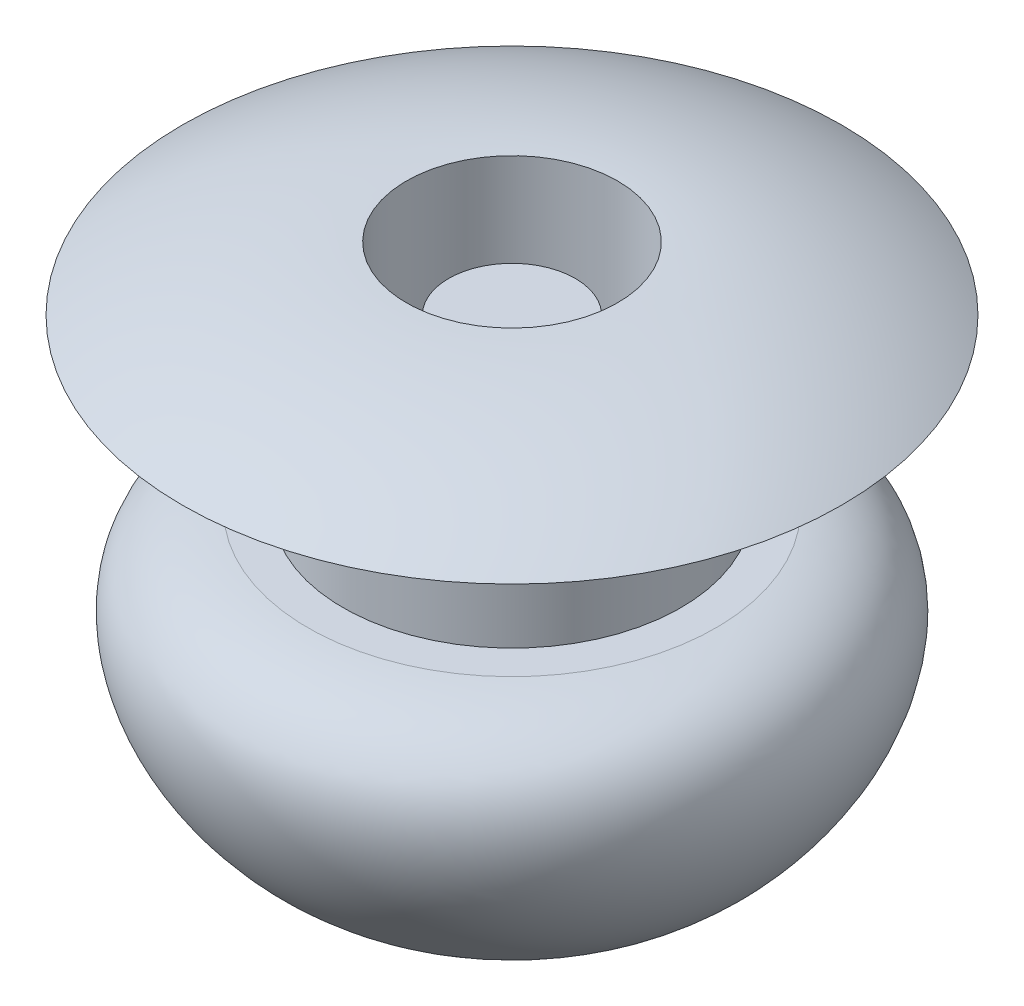
from build123d import *


with BuildPart() as part:
    # Szkic1 → Obrót1 (revolve)
    with BuildSketch(Plane(origin=(0, 0, 0), x_dir=(0, 0, -1), z_dir=(1, 0, 0))):
        with BuildLine():
            Line((0, 0), (0, -2.000008703))
            Line((0, -2.000008703), (0, -3.500008703))
            add(Edge.make_bspline(
                [(-0.956030427, -3.378199373), (-0.520263876, -3.500008703), (0, -3.500008703)],
                knots=[4.134444875, 4.134444875, 4.134444875, 4.71238898, 4.71238898, 4.71238898], degree=2, weights=[1, 0.958537313, 1]))
            add(Edge.make_bspline(
                [(-2.413891755, -2.000008703), (-3.858559437, -2.163305389), (-3.558358928, -4.322989065), (-0.971318098, -5.871948719), (-0.341145137, -3.792040612), (-0.956030427, -3.378199373)],
                knots=[0, 0, 0, 0, 0.454219308, 0.705200672, 1, 1, 1, 1], degree=3))
            Line((-2.413891755, -2.000008703), (-2, -2.000008703))
            Line((-2, -2.000008703), (-2, 0))
            Line((-2, 0), (-3.9, 0))
            ThreePointArc((-3.9, 0), (-2.627043935, 0.558888572), (-1.25, 0.75))
            Line((-1.25, 0.75), (-1.25, -2.000008703))
            Line((-1.25, -2.000008703), (-0.75, -2.000008703))
            Line((-0.75, -2.000008703), (-0.75, 0))
            Line((-0.75, 0), (0, 0))
        make_face()
    revolve(axis=Axis((0, 0, 0), (0, 1, 0)))


solid = part.part
